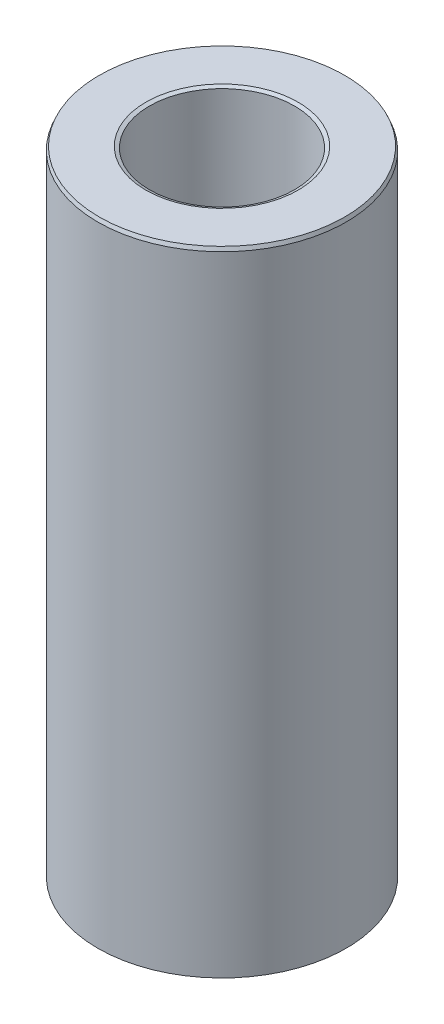
from build123d import *
from OCP.BRepFilletAPI import BRepFilletAPI_MakeChamfer

# Parameters (mm, degrees)
SKETCH1_R           = 50
BOSS_EXTRUDE1_DEPTH = 255.204608441
SKETCH2_R           = 29.210600295
CUT_EXTRUDE1_DEPTH  = 265.819546427
CHAMFER1_SIZE       = 1.459348283
CHAMFER1_SIZE2      = 0.59863721


with BuildPart() as part:
    # Sketch1 → Boss-Extrude1 (new body)
    with BuildSketch(Plane(origin=(0, 0, 0), x_dir=(1, 0, 0), z_dir=(0, 1, 0))):
        Circle(SKETCH1_R)
    extrude(amount=BOSS_EXTRUDE1_DEPTH)

    # Sketch2 → Cut-Extrude1 (cut, through all)
    with BuildSketch(Plane(origin=(0, 0, 0), x_dir=(1, 0, 0), z_dir=(0, 1, 0))):
        Circle(SKETCH2_R)
    extrude(amount=CUT_EXTRUDE1_DEPTH, mode=Mode.SUBTRACT)

    # Chamfer1: one chamfer whose edges measure the first distance from different faces: ONE call of the kernel's chamfer builder (chamfer() names one face for all edges)
    chamfer1_edges_1 = [part.edges().sort_by_distance(p)[0] for p in [
        (-29.210600295, 255.204608441, 0),
    ]]
    chamfer1_side_1 = [part.faces().sort_by_distance(p)[0] for p in [
        (-48.585786438, 255.204608441, 0),
    ]]
    chamfer1_edges_2 = [part.edges().sort_by_distance(p)[0] for p in [
        (-29.210600295, 0, 0),
    ]]
    chamfer1_side_2 = [part.faces().sort_by_distance(p)[0] for p in [
        (-29.210600295, 127.602304221, 0),
    ]]
    chamfer1_edges_3 = [part.edges().sort_by_distance(p)[0] for p in [
        (-50, 0, 0),
    ]]
    chamfer1_side_3 = [part.faces().sort_by_distance(p)[0] for p in [
        (-48.585786438, 0, 0),
    ]]
    chamfer1_edges_4 = [part.edges().sort_by_distance(p)[0] for p in [
        (-50, 255.204608441, 0),
    ]]
    chamfer1_side_4 = [part.faces().sort_by_distance(p)[0] for p in [
        (-50, 127.602304221, 0),
    ]]
    chamfer1 = BRepFilletAPI_MakeChamfer(part.part.solid().wrapped)
    for e in chamfer1_edges_1:
        chamfer1.Add(CHAMFER1_SIZE, CHAMFER1_SIZE2, e.wrapped, chamfer1_side_1[0].wrapped)  # the first distance lies on this face
    for e in chamfer1_edges_2:
        chamfer1.Add(CHAMFER1_SIZE, CHAMFER1_SIZE2, e.wrapped, chamfer1_side_2[0].wrapped)  # the first distance lies on this face
    for e in chamfer1_edges_3:
        chamfer1.Add(CHAMFER1_SIZE, CHAMFER1_SIZE2, e.wrapped, chamfer1_side_3[0].wrapped)  # the first distance lies on this face
    for e in chamfer1_edges_4:
        chamfer1.Add(CHAMFER1_SIZE, CHAMFER1_SIZE2, e.wrapped, chamfer1_side_4[0].wrapped)  # the first distance lies on this face
    add(Compound.cast(chamfer1.Shape()), mode=Mode.REPLACE)


solid = part.part
